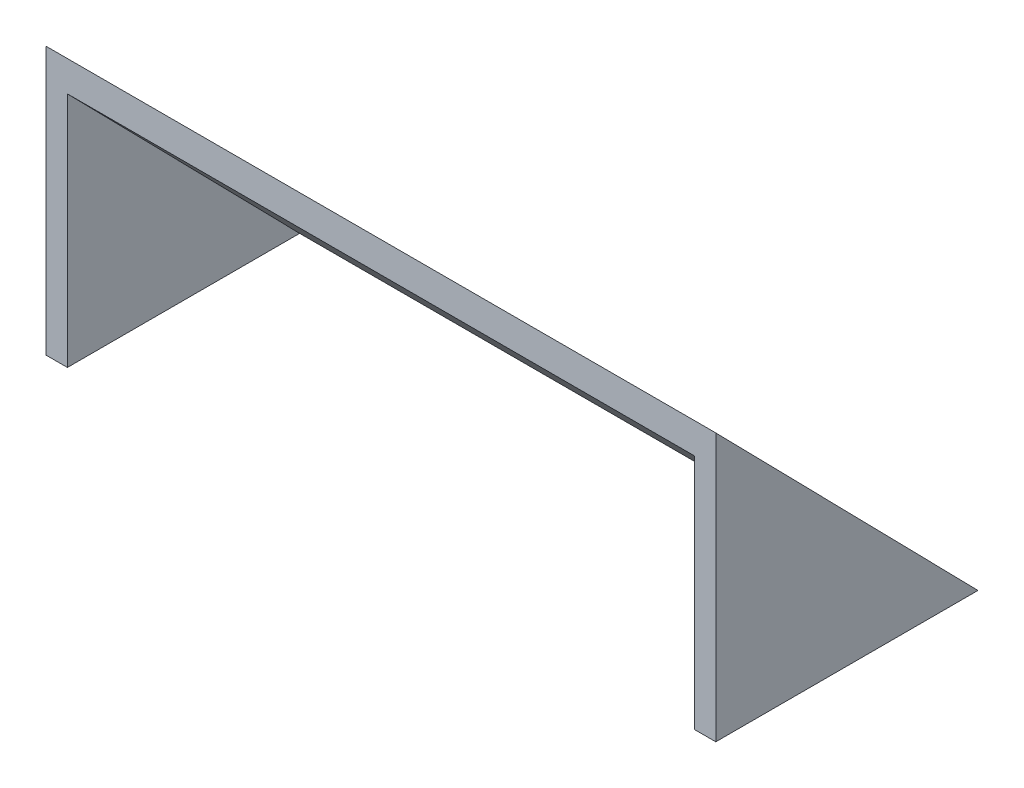
from build123d import *

# Parameters (mm, degrees)
P_IDAT_VYSUNUT_M1_DEPTH  = 1.2
SKICA2_W                 = 35.15
SKICA2_H                 = 21.002142748
P_IDAT_VYSUNUT_M2_DEPTH  = 1.2
LINPOLE1_COUNT           = 2
LINPOLE1_PITCH           = 36.35
SKICA3_W                 = 1.514942373
SKICA3_H                 = 4.337658353
SKICA3_W_2               = 4.469235766
SKICA3_H_2               = 2.531504847
ODEBRAT_VYSUNUT_M1_DEPTH = 44.024324515


with BuildPart() as part:
    # Skica1 → Přidat vysunutím1 (new body)
    with BuildSketch(Plane(origin=(0, 0, 0), x_dir=(0, 0, -1), z_dir=(1, 0, 0))):
        Polygon((0, 0), (0, 15), (14.7, 0), align=None)
    p_idat_vysunut_m1 = extrude(amount=P_IDAT_VYSUNUT_M1_DEPTH)

    # Skica2 → Přidat vysunutím2 (add)
    with BuildSketch(Plane(origin=(0, 7.348500306, -7.4984697), x_dir=(-1, 0, 0), z_dir=(0, 0.699928582359657, -0.7142128391425073))):
        with Locations((-18.775, 0.212121213)):
            Rectangle(SKICA2_W, SKICA2_H)
    extrude(amount=-P_IDAT_VYSUNUT_M2_DEPTH)

    # LinPole1: Přidat vysunutím1 ×2
    with Locations(*[(i * LINPOLE1_PITCH, 0, 0) for i in range(1, LINPOLE1_COUNT)]):
        add(p_idat_vysunut_m1)

    # Skica3 → Odebrat vysunutím1 (cut, through all)
    with BuildSketch(Plane(origin=(37.55, 0, 0), x_dir=(0, 0, -1), z_dir=(1, 0, 0))):
        with Locations((-0.757471187, 14.835442882)):
            Rectangle(SKICA3_W, SKICA3_H)
        with Locations((14.29761418, -1.265752424)):
            Rectangle(SKICA3_W_2, SKICA3_H_2)
    extrude(amount=-ODEBRAT_VYSUNUT_M1_DEPTH, mode=Mode.SUBTRACT)


solid = part.part
